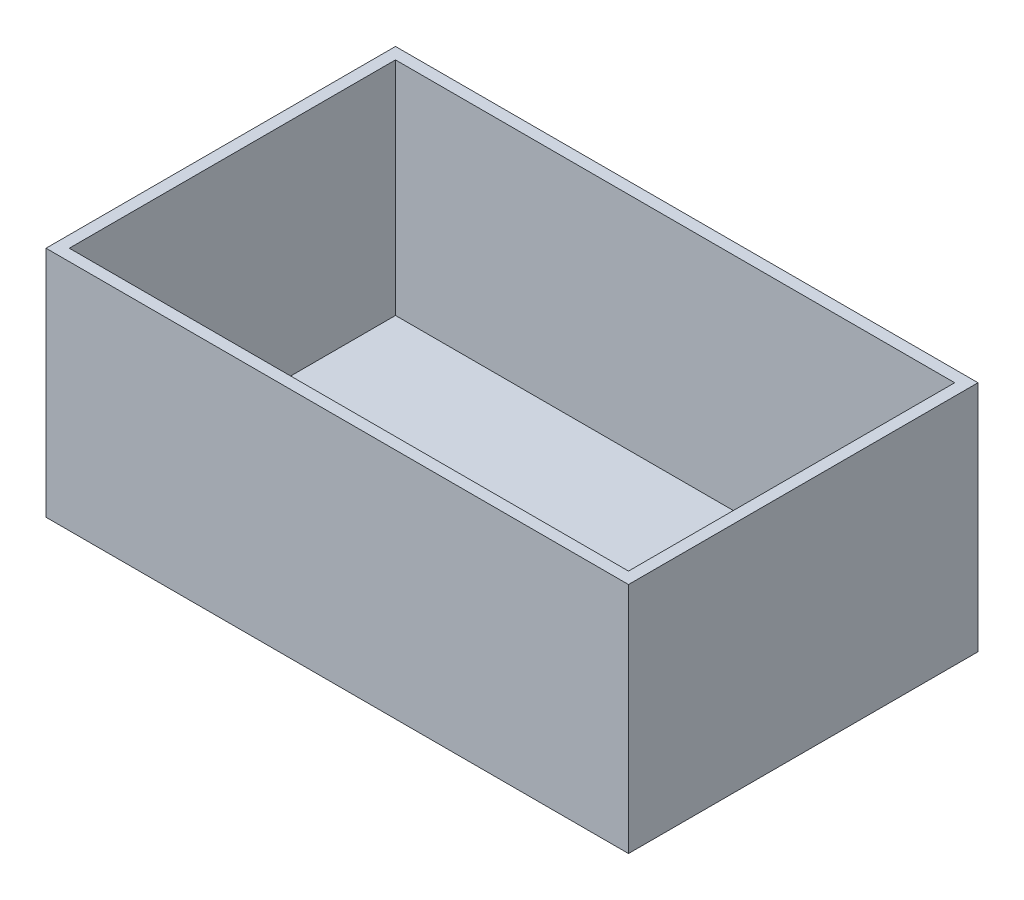
from build123d import *

# Parameters (mm, degrees)
SKETCH1_W                = 500
SKETCH1_H                = 200
BOSS_EXTRUDE1_DEPTH      = 300
BOSS_EXTRUDE2_DEPTH      = 20
BOSS_EXTRUDE2_DEPTH_BACK = 20
SHELL1_START             = -240
SHELL1_OUTLINE_W         = 190
SHELL1_OUTLINE_H         = 280
SHELL1_DEPTH             = 480


# Read off the part's stored shape, not the designer's step: Shell1
with BuildPart() as part:
    # Sketch1 → Boss-Extrude1 (new body)
    with BuildSketch(Plane.XY):
        Rectangle(SKETCH1_W, SKETCH1_H)
    extrude(amount=BOSS_EXTRUDE1_DEPTH)

    # Sketch2 → Boss-Extrude2 (add, two sides: drawn at the far end of the back side and taken through both)
    with BuildSketch(Plane(origin=(0, 0, 0), x_dir=(1, 0, 0), z_dir=(0, 1, 0)).offset(-BOSS_EXTRUDE2_DEPTH_BACK)):
        Polygon((25, 0), (25, 30), (-25, 30), (-25, 0), (-35, 0), (-35, 40), (35, 40), (35, 0), align=None)
    extrude(amount=BOSS_EXTRUDE2_DEPTH + BOSS_EXTRUDE2_DEPTH_BACK)

    # Shell1 outline → Shell1 (cut)
    with BuildSketch(Plane.YZ.offset(SHELL1_START)):
        with Locations((5, 150)):
            Rectangle(SHELL1_OUTLINE_W, SHELL1_OUTLINE_H)
    extrude(amount=SHELL1_DEPTH, mode=Mode.SUBTRACT)


solid = part.part
